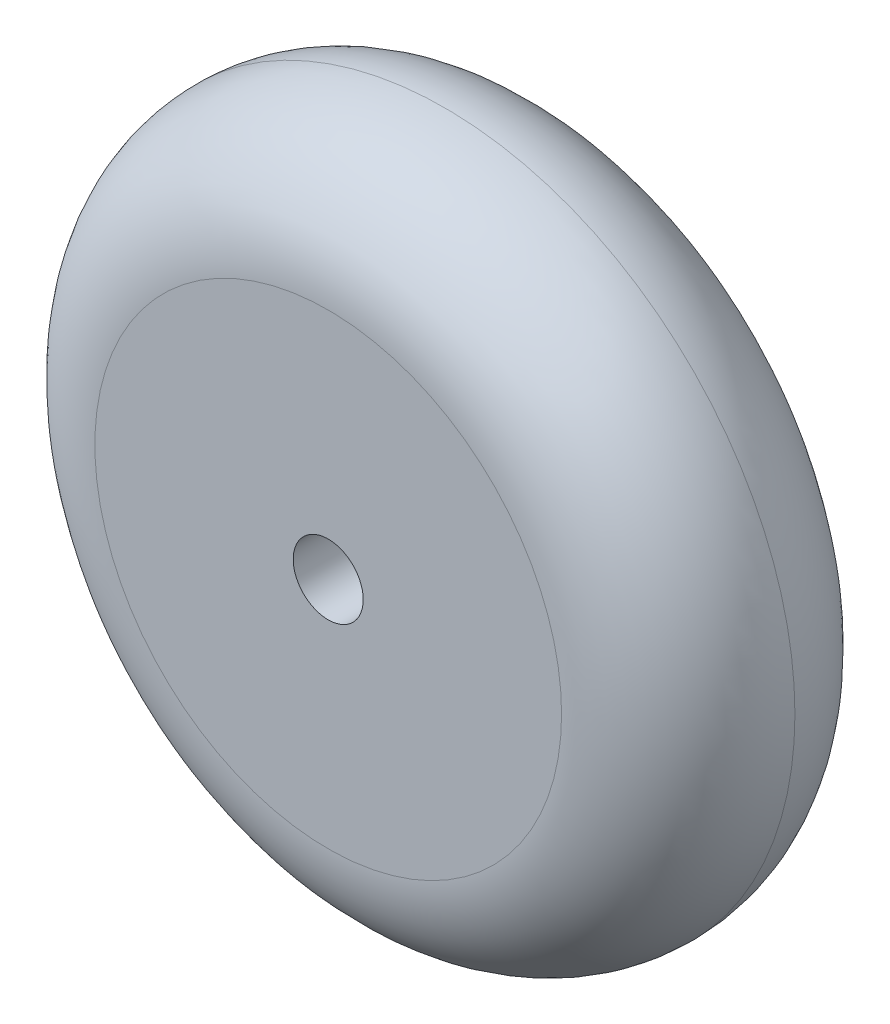
from build123d import *

# Parameters (mm, degrees)
SKETCH1_R           = 15
BOSS_EXTRUDE1_DEPTH = 10
FILLET1_R           = 5
FILLET2_R           = 5
SKETCH2_R           = 1.5
CUT_EXTRUDE1_DEPTH  = 24.452078799


with BuildPart() as part:
    # Sketch1 → Boss-Extrude1 (new body)
    with BuildSketch(Plane.XY):
        Circle(SKETCH1_R)
    extrude(amount=BOSS_EXTRUDE1_DEPTH)

    # Fillet1
    fillet1_edges = [part.edges().sort_by_distance(p)[0] for p in [
        (-15, 0, 10),
    ]]
    fillet(fillet1_edges, radius=FILLET1_R)

    # Fillet2
    fillet2_edges = [part.edges().sort_by_distance(p)[0] for p in [
        (-15, 0, 0),
    ]]
    fillet(fillet2_edges, radius=FILLET2_R - 0.0001)  # a hair under: the kernel refuses the full size

    # Sketch2 → Cut-Extrude1 (cut, through all)
    with BuildSketch(Plane.XY.offset(10)):
        Circle(SKETCH2_R)
    extrude(amount=-CUT_EXTRUDE1_DEPTH, mode=Mode.SUBTRACT)


solid = part.part
